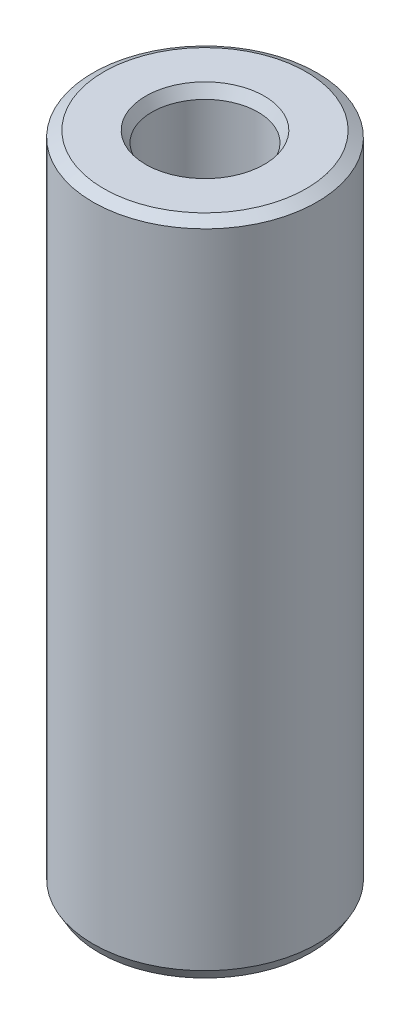
from build123d import *
from OCP.BRepFilletAPI import BRepFilletAPI_MakeChamfer

# Parameters (mm, degrees)
SKETCH1_R           = 52.5
BOSS_EXTRUDE1_DEPTH = 309.060092193
SKETCH2_R           = 24.871410485
CUT_EXTRUDE1_DEPTH  = 318.853174573
CHAMFER1_SIZE       = 2.919427137
CHAMFER1_SIZE2      = 5.056596131


with BuildPart() as part:
    # Sketch1 → Boss-Extrude1 (new body)
    with BuildSketch(Plane(origin=(0, 0, 0), x_dir=(1, 0, 0), z_dir=(0, 1, 0))):
        Circle(SKETCH1_R)
    extrude(amount=BOSS_EXTRUDE1_DEPTH)

    # Sketch2 → Cut-Extrude1 (cut, through all)
    with BuildSketch(Plane(origin=(0, 0, 0), x_dir=(1, 0, 0), z_dir=(0, 1, 0))):
        Circle(SKETCH2_R)
    extrude(amount=CUT_EXTRUDE1_DEPTH, mode=Mode.SUBTRACT)

    # Chamfer1: one chamfer whose edges measure the first distance from different faces: ONE call of the kernel's chamfer builder (chamfer() names one face for all edges)
    chamfer1_edges_1 = [part.edges().sort_by_distance(p)[0] for p in [
        (-24.871410485, 309.060092193, 0),
    ]]
    chamfer1_side_1 = [part.faces().sort_by_distance(p)[0] for p in [
        (-51.01507576, 309.060092193, 0),
    ]]
    chamfer1_edges_2 = [part.edges().sort_by_distance(p)[0] for p in [
        (-24.871410485, 0, 0),
    ]]
    chamfer1_side_2 = [part.faces().sort_by_distance(p)[0] for p in [
        (-24.871410485, 154.530046097, 0),
    ]]
    chamfer1_edges_3 = [part.edges().sort_by_distance(p)[0] for p in [
        (-52.5, 0, 0),
    ]]
    chamfer1_side_3 = [part.faces().sort_by_distance(p)[0] for p in [
        (-51.01507576, 0, 0),
    ]]
    chamfer1_edges_4 = [part.edges().sort_by_distance(p)[0] for p in [
        (-52.5, 309.060092193, 0),
    ]]
    chamfer1_side_4 = [part.faces().sort_by_distance(p)[0] for p in [
        (-52.5, 154.530046097, 0),
    ]]
    chamfer1 = BRepFilletAPI_MakeChamfer(part.part.solid().wrapped)
    for e in chamfer1_edges_1:
        chamfer1.Add(CHAMFER1_SIZE, CHAMFER1_SIZE2, e.wrapped, chamfer1_side_1[0].wrapped)  # the first distance lies on this face
    for e in chamfer1_edges_2:
        chamfer1.Add(CHAMFER1_SIZE, CHAMFER1_SIZE2, e.wrapped, chamfer1_side_2[0].wrapped)  # the first distance lies on this face
    for e in chamfer1_edges_3:
        chamfer1.Add(CHAMFER1_SIZE, CHAMFER1_SIZE2, e.wrapped, chamfer1_side_3[0].wrapped)  # the first distance lies on this face
    for e in chamfer1_edges_4:
        chamfer1.Add(CHAMFER1_SIZE, CHAMFER1_SIZE2, e.wrapped, chamfer1_side_4[0].wrapped)  # the first distance lies on this face
    add(Compound.cast(chamfer1.Shape()), mode=Mode.REPLACE)


solid = part.part
